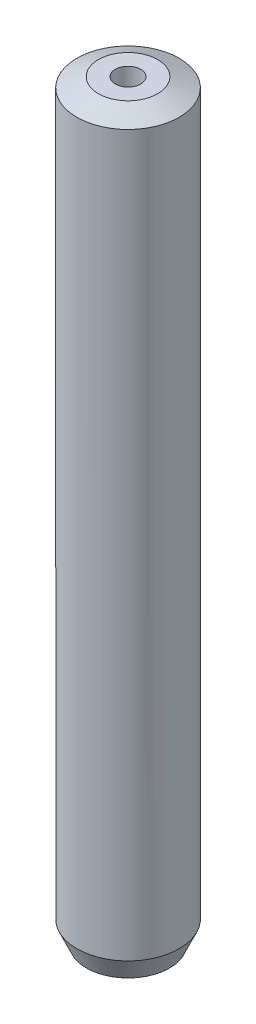
from build123d import *
from OCP.BRepFilletAPI import BRepFilletAPI_MakeChamfer

# Parameters (mm, degrees)
SKETCH1_R           = 7.5
BOSS_EXTRUDE1_DEPTH = 110.110370824
SKETCH2_R           = 1.868616292
CUT_EXTRUDE1_DEPTH  = 111.620042321
CHAMFER1_SIZE       = 1.407280434
CHAMFER1_SIZE2      = 3.161531763


with BuildPart() as part:
    # Sketch1 → Boss-Extrude1 (new body)
    with BuildSketch(Plane(origin=(0, 0, 0), x_dir=(1, 0, 0), z_dir=(0, 1, 0))):
        Circle(SKETCH1_R)
    extrude(amount=BOSS_EXTRUDE1_DEPTH)

    # Sketch2 → Cut-Extrude1 (cut, through all)
    with BuildSketch(Plane(origin=(0, 0, 0), x_dir=(1, 0, 0), z_dir=(0, 1, 0))):
        Circle(SKETCH2_R)
    extrude(amount=CUT_EXTRUDE1_DEPTH, mode=Mode.SUBTRACT)

    # Chamfer1: one chamfer whose edges measure the first distance from different faces: ONE call of the kernel's chamfer builder (chamfer() names one face for all edges)
    chamfer1_edges_1 = [part.edges().sort_by_distance(p)[0] for p in [
        (-7.5, 110.110370824, 0),
    ]]
    chamfer1_side_1 = [part.faces().sort_by_distance(p)[0] for p in [
        (-7.5, 55.055185412, 0),
    ]]
    chamfer1_edges_2 = [part.edges().sort_by_distance(p)[0] for p in [
        (-7.5, 0, 0),
    ]]
    chamfer1_side_2 = [part.faces().sort_by_distance(p)[0] for p in [
        (-7.287867966, 0, 0),
    ]]
    chamfer1 = BRepFilletAPI_MakeChamfer(part.part.solid().wrapped)
    for e in chamfer1_edges_1:
        chamfer1.Add(CHAMFER1_SIZE, CHAMFER1_SIZE2, e.wrapped, chamfer1_side_1[0].wrapped)  # the first distance lies on this face
    for e in chamfer1_edges_2:
        chamfer1.Add(CHAMFER1_SIZE, CHAMFER1_SIZE2, e.wrapped, chamfer1_side_2[0].wrapped)  # the first distance lies on this face
    add(Compound.cast(chamfer1.Shape()), mode=Mode.REPLACE)


solid = part.part
